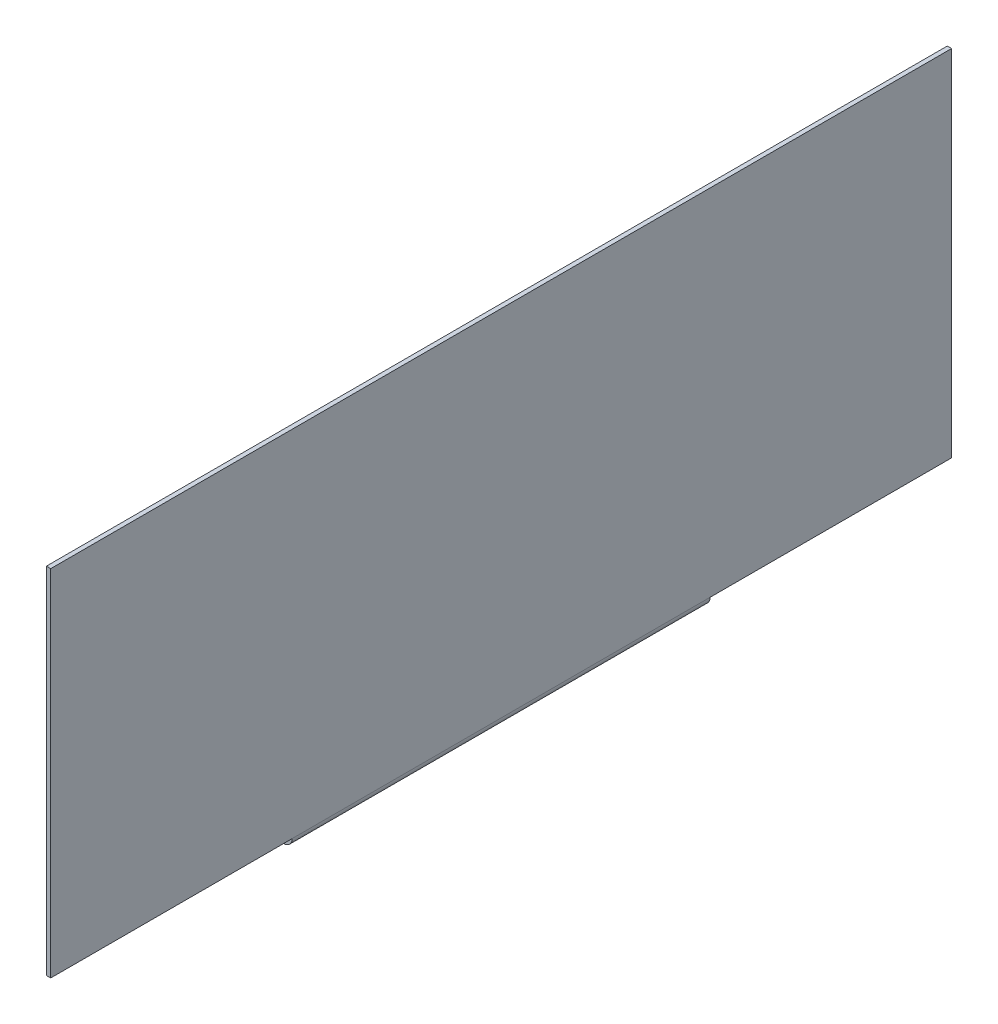
from build123d import *

# Parameters (mm, degrees)
SKETCH1_W          = 661.58618
SKETCH1_H          = 260.35
BASE_FLANGE1_DEPTH = 3.175
EDGE_FLANGE1_DEPTH = 306.87772


# Sheet-metal steps are written as plain solids
with BuildPart() as part:
    # Sketch1 → Base-Flange1 (new body)
    with BuildSketch(Plane(origin=(0, 0, 0), x_dir=(0, 0, -1), z_dir=(1, 0, 0))):
        Rectangle(SKETCH1_W, SKETCH1_H)
    extrude(amount=-BASE_FLANGE1_DEPTH)

    # Edge-Flange1 section (across the edge) → Edge-Flange1 (add)
    with BuildSketch(Plane(origin=(-3.175, -133.35, -153.43886), x_dir=(0, 1, 0), z_dir=(0, 0, 1))):
        with BuildLine():
            Line((-3.175, 3.175), (-3.175, 22.225))
            Line((-3.175, 22.225), (0, 22.225))
            Line((0, 22.225), (0, 3.175))
            ThreePointArc((0, 3.175), (0.92993597, 0.92993597), (3.175, 0))
            Line((3.175, 0), (3.175, -3.175))
            ThreePointArc((3.175, -3.175), (-1.315128061, -1.315128061), (-3.175, 3.175))
        make_face()
    extrude(amount=EDGE_FLANGE1_DEPTH)


solid = part.part
